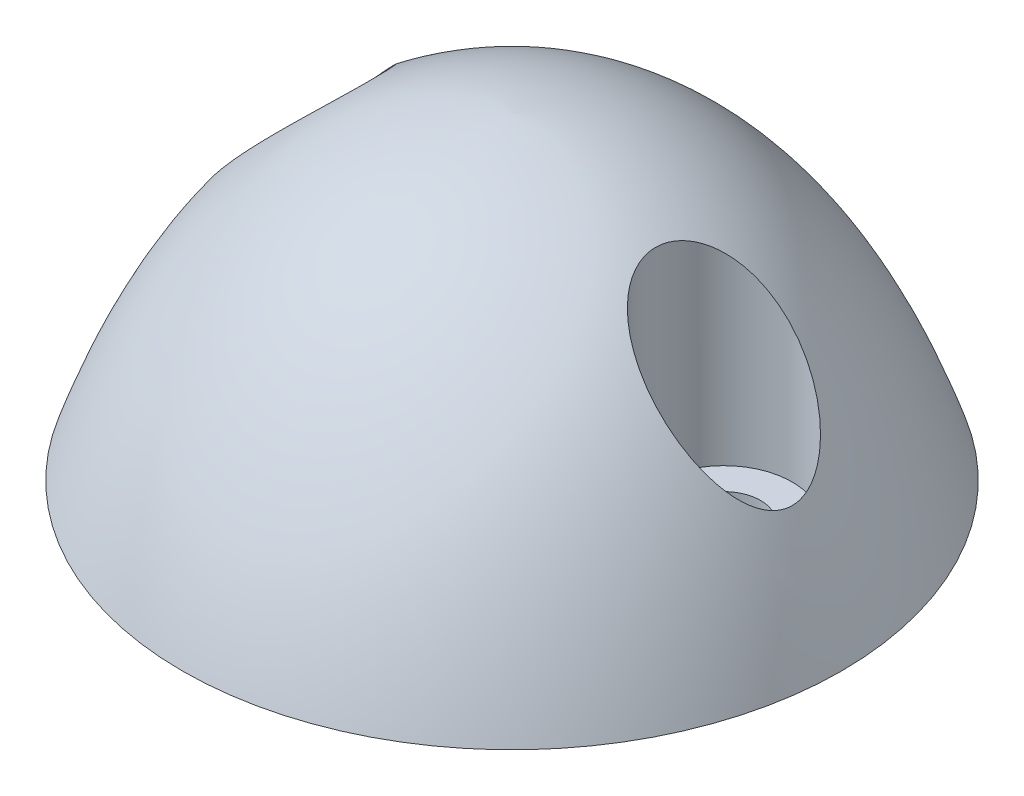
from build123d import *

# Parameters (mm, degrees)
Y_KSEKLIK_EKSTR_ZYON2_REACH = 25.964
IZIM1_R                     = 3
IZIM2_R                     = 1.55
KES_EKSTR_ZYON3_DEPTH       = 20
IZIM3_R                     = 2.9
KES_EKSTR_ZYON4_DEPTH       = 17


with BuildPart() as part:
    # Sketch1 → Revolve1 (revolve)
    with BuildSketch(Plane.XY):
        with BuildLine():
            Line((12.5, 0), (14, 0))
            add(Edge.make_bspline(
                [(14, 0), (9.754342575, 12.950892033), (0, 13.5)],
                knots=[0, 0, 0, 0.755787306, 0.755787306, 0.755787306], degree=2))
            Line((0, 13.5), (0, 12))
            add(Edge.make_bspline(
                [(0, 12), (4.177365263, 12.464584475), (11.726255978, 7.489936964), (12.5, 0)],
                knots=[0, 0, 0, 0, 0.828663255, 0.828663255, 0.828663255, 0.828663255], degree=3))
        make_face()
    revolve(axis=Axis((0, 13.5, 0), (0, -1, 0)))

    # Çizim1 → Yükseklik-Ekstrüzyon2 (add, up to next)
    with BuildSketch(Plane(origin=(0, 0, 0), x_dir=(1, 0, 0), z_dir=(0, 1, 0)), mode=Mode.PRIVATE) as y_kseklik_ekstr_zyon2_sk1:
        with Locations((9, 0)):
            Circle(IZIM1_R)
    y_kseklik_ekstr_zyon2_tool1 = extrude(y_kseklik_ekstr_zyon2_sk1.sketch, amount=Y_KSEKLIK_EKSTR_ZYON2_REACH, mode=Mode.PRIVATE) - part.part
    # Çizim1 → Yükseklik-Ekstrüzyon2 (add, up to next)
    with BuildSketch(Plane(origin=(0, 0, 0), x_dir=(1, 0, 0), z_dir=(0, 1, 0)), mode=Mode.PRIVATE) as y_kseklik_ekstr_zyon2_sk2:
        with Locations((-9, 0)):
            Circle(IZIM1_R)
    y_kseklik_ekstr_zyon2_tool2 = extrude(y_kseklik_ekstr_zyon2_sk2.sketch, amount=Y_KSEKLIK_EKSTR_ZYON2_REACH, mode=Mode.PRIVATE) - part.part
    add(y_kseklik_ekstr_zyon2_tool1.solids().sort_by_distance((9, 0, 0))[0])
    add(y_kseklik_ekstr_zyon2_tool2.solids().sort_by_distance((-9, 0, 0))[0])

    # Çizim2 → Kes-Ekstrüzyon3 (cut)
    with BuildSketch(Plane(origin=(0, 0, 0), x_dir=(1, 0, 0), z_dir=(0, 1, 0))):
        with Locations((9, 0)):
            Circle(IZIM2_R)
        with Locations((-9, 0)):
            Circle(IZIM2_R)
    extrude(amount=KES_EKSTR_ZYON3_DEPTH, mode=Mode.SUBTRACT)

    # Çizim3 → Kes-Ekstrüzyon4 (cut)
    with BuildSketch(Plane(origin=(0, 20, 0), x_dir=(1, 0, 0), z_dir=(0, 1, 0))):
        with Locations((9, 0)):
            Circle(IZIM3_R)
        with Locations((-9, 0)):
            Circle(IZIM3_R)
    extrude(amount=-KES_EKSTR_ZYON4_DEPTH, mode=Mode.SUBTRACT)


solid = part.part
